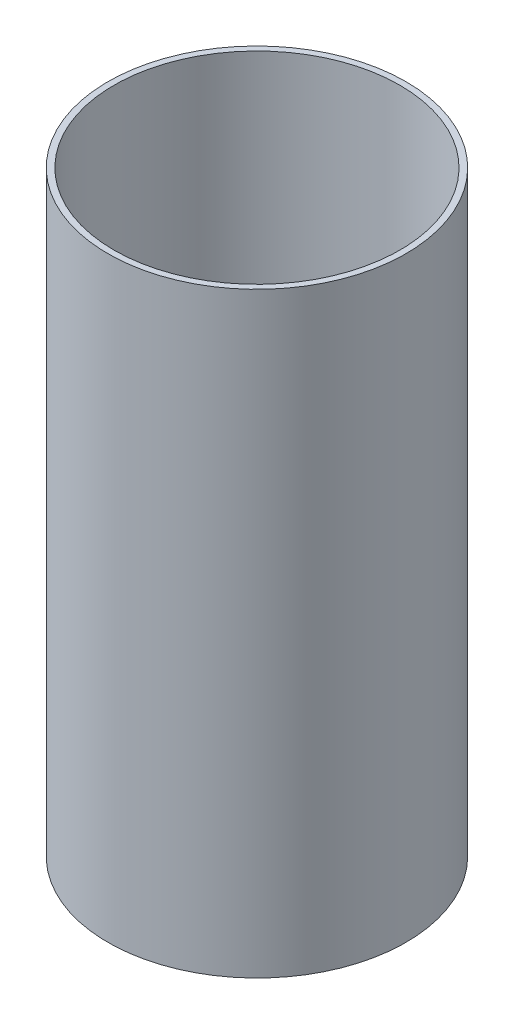
from build123d import *

# Parameters (mm, degrees)
SKETCH1_R           = 38.0746
SKETCH1_R_2         = 36.5125
BOSS_EXTRUDE1_DEPTH = 152.4


with BuildPart() as part:
    # Sketch1 → Boss-Extrude1 (new body)
    with BuildSketch(Plane(origin=(0, 0, 0), x_dir=(1, 0, 0), z_dir=(0, 1, 0))):
        Circle(SKETCH1_R)
        Circle(SKETCH1_R_2, mode=Mode.SUBTRACT)
    extrude(amount=BOSS_EXTRUDE1_DEPTH)


solid = part.part
